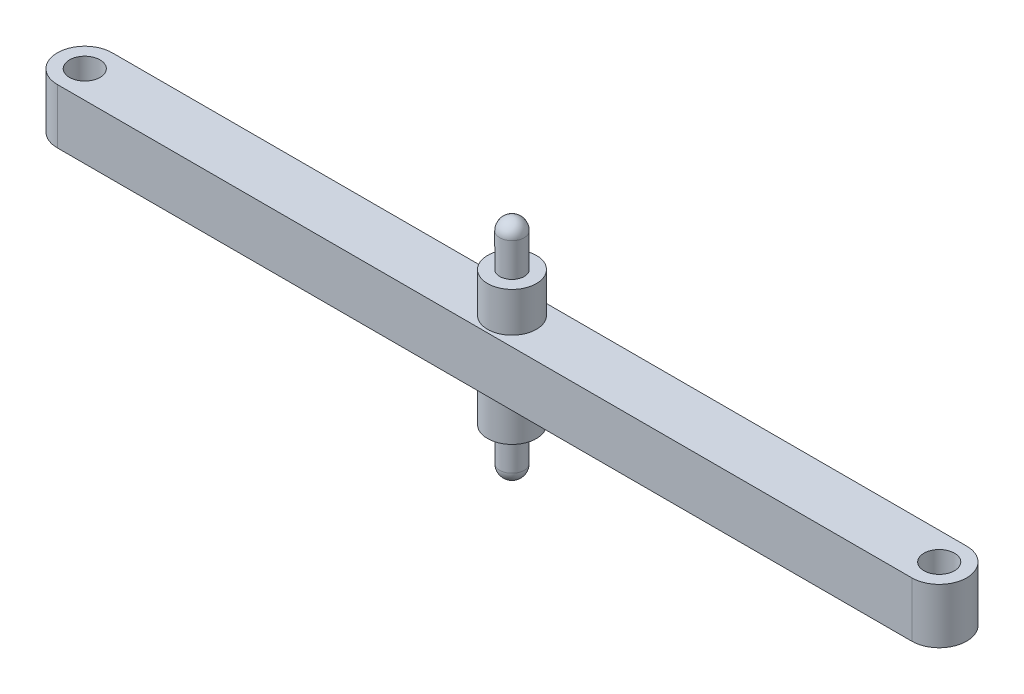
from build123d import *

# Parameters (mm, degrees)
BOSS_EXTRUDE1_DEPTH          = 9
SKETCH2_R                    = 4
BOSS_EXTRUDE2_DEPTH          = 6.5
BOSS_EXTRUDE4_START          = 6.5
SKETCH4_R                    = 4
BOSS_EXTRUDE4_DEPTH          = 6.5
F_5_0_5_DIAMETER_HOLE1_D     = 5
F_5_0_5_DIAMETER_HOLE1_DEPTH = 23


# Read off the part's stored shape, not the designer's step: Boss-Extrude3, Boss-Extrude5
with BuildPart() as part:
    # Sketch1 → Boss-Extrude1 (new body)
    with BuildSketch(Plane(origin=(0, 4.5, 0), x_dir=(1, 0, 0), z_dir=(0, 1, 0))):
        with BuildLine():
            Line((-30, -82.5), (110, -82.5))
            ThreePointArc((110, -82.5), (114.5, -78), (110, -73.5))
            Line((110, -73.5), (-30, -73.5))
            ThreePointArc((-30, -73.5), (-34.5, -78), (-30, -82.5))
        make_face()
    extrude(amount=-BOSS_EXTRUDE1_DEPTH)

    # Sketch2 → Boss-Extrude2 (add)
    with BuildSketch(Plane(origin=(0, 4.5, 0), x_dir=(-1, 0, 0), z_dir=(0, 1, 0))):
        with Locations(Location((-40, 78, 0), (0, 0, 270))):
            Circle(SKETCH2_R)
    extrude(amount=BOSS_EXTRUDE2_DEPTH)

    # Boss-Extrude3 outline → Boss-Extrude3 (revolve)
    with BuildSketch(Plane(origin=(40, 0, 78), x_dir=(1, 0, 0), z_dir=(0, 0, 1))):
        with BuildLine():
            Line((2, 11), (2, 16.499999998))
            ThreePointArc((2, 16.499999998), (1.414213563, 17.914213562), (0, 18.5))
            Line((0, 18.5), (0, 11))
            Line((0, 11), (2, 11))
        make_face()
    revolve(axis=Axis((40, 0, 78), (0, 1, 0)))

    # Sketch4 → Boss-Extrude4 (add)
    with BuildSketch(Plane.XZ.offset(4.5).offset(BOSS_EXTRUDE4_START)):
        with Locations(Location((40, 78, 0), (0, 0, 270))):
            Circle(SKETCH4_R)
    extrude(amount=-BOSS_EXTRUDE4_DEPTH)

    # Boss-Extrude5 outline → Boss-Extrude5 (revolve)
    with BuildSketch(Plane(origin=(40, 0, 78), x_dir=(1, 0, 0), z_dir=(0, 0, 1))):
        with BuildLine():
            ThreePointArc((0, -18.5), (1.414213563, -17.914213562), (2, -16.499999998))
            Line((2, -16.499999998), (2, -11))
            Line((2, -11), (0, -11))
            Line((0, -11), (0, -18.5))
        make_face()
    revolve(axis=Axis((40, 0, 78), (0, 1, 0)))

    # Ø5.0 (5) Diameter Hole1
    with Locations(Plane(origin=(0, 4.5, 0), x_dir=(1, 0, 0), z_dir=(0, 1, 0))):
        with Locations((-30, -78), (110, -78)):
            Hole(F_5_0_5_DIAMETER_HOLE1_D / 2, depth=F_5_0_5_DIAMETER_HOLE1_DEPTH)


solid = part.part
